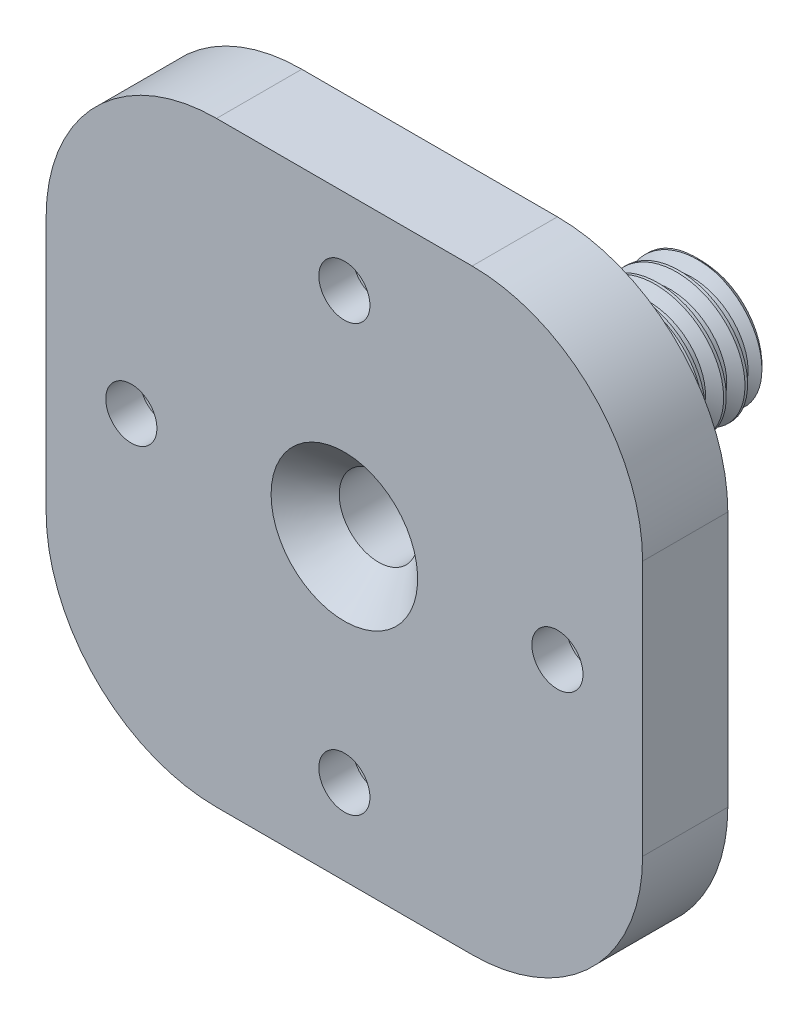
from build123d import *

# Parameters (mm, degrees)
CROQUIS1_R                 = 3.9
SALIENTE_EXTRUIR1_DEPTH    = 7
CHAFL_N2_SIZE              = 0.4
ROSCA1_PITCH               = 1.25
CROQUIS20_R                = 3.95
SALIENTE_EXTRUIR2_DEPTH    = 7
CROQUIS21_R                = 5.5
SALIENTE_EXTRUIR3_DEPTH    = 2
CROQUIS23_W                = 35
CROQUIS23_H                = 35
CROQUIS23_R                = 1.5
SALIENTE_EXTRUIR4_DEPTH    = 5
CHAFL_N3_SIZE              = 2
CROQUIS24_R                = 3.5
CORTAR_EXTRUIR2_DEPTH      = 3
CORTAR_EXTRUIR1_DEPTH      = 29.434134416
CORTAR_EXTRUIR1_DEPTH_BACK = 29.434134416
CROQUIS1_3_R               = 2.3
CHAFL_N4_SIZE              = 2
REDONDEO1_R                = 10


with BuildPart() as part:
    # Croquis1 → Saliente-Extruir1 (new body)
    with BuildSketch(Plane.XY):
        Circle(CROQUIS1_R)
    extrude(amount=-SALIENTE_EXTRUIR1_DEPTH)

    # Chaflán2
    chafl_n2_edges = [part.edges().sort_by_distance(p)[0] for p in [
        (-3.9, 0, -7),
    ]]
    chamfer(chafl_n2_edges, length=CHAFL_N2_SIZE)

    # Rosca1: the profile of Perfil de rosca1 profile screwed along a right-hand helix of 7.2 turns, 8 arcs to a turn; built about Z, then put on its axis
    rosca1_z = Axis((0, 0, 0), (0, 0, 1))
    rosca1_corners = [(3.9003, 0, -0.000173205), (3.9003, 0, 1.093923202), (3.223417656, 0, 0.703124998), (3.223417656, 0, 0.390624998)]
    with BuildLine(mode=Mode.PRIVATE) as rosca1_profile:
        Line(rosca1_corners[0], rosca1_corners[1])
        Line(rosca1_corners[1], rosca1_corners[2])
        Line(rosca1_corners[2], rosca1_corners[3])
        Line(rosca1_corners[3], rosca1_corners[0])
    rosca1_cap = Face(rosca1_profile.wire())
    rosca1_turn_angles = [0, 22.5, 45, 67.5, 90, 112.5, 135, 157.5, 180, 202.5, 225, 247.5, 270, 292.5, 315, 337.5, 360]
    rosca1_turn_weights = [1, 0.9238795325112867, 1, 0.9238795325112867, 1, 0.9238795325112867, 1, 0.9238795325112867, 1, 0.9238795325112867, 1, 0.9238795325112867, 1, 0.9238795325112867, 1, 0.9238795325112867, 1]
    rosca1_turn_rails = [Edge.make_bspline([Vector(p[0], p[1], 0).rotate(rosca1_z, rosca1_turn_angles[k]) / rosca1_turn_weights[k] + Vector(0, 0, p[2] + ROSCA1_PITCH * rosca1_turn_angles[k] / 360) for k in range(17)], [0, 0, 0, 1, 1, 2, 2, 3, 3, 4, 4, 5, 5, 6, 6, 7, 7, 8, 8, 8], 2, rosca1_turn_weights) for p in rosca1_corners]
    rosca1_turn_sides = [Face.make_surface_from_curves(rosca1_turn_rails[p[0]], rosca1_turn_rails[p[1]]) for p in [(0, 1), (1, 2), (2, 3), (3, 0)]]
    rosca1_last_angles = [2520, 2542.5, 2565, 2578.5, 2592]
    rosca1_last_weights = [1, 0.9238795325112867, 1, 0.9723699203976766, 1]
    rosca1_last_rails = [Edge.make_bspline([Vector(p[0], p[1], 0).rotate(rosca1_z, rosca1_last_angles[k]) / rosca1_last_weights[k] + Vector(0, 0, p[2] + ROSCA1_PITCH * rosca1_last_angles[k] / 360) for k in range(5)], [0, 0, 0, 1, 1, 2, 2, 2], 2, rosca1_last_weights) for p in rosca1_corners]
    rosca1_last_sides = [Face.make_surface_from_curves(rosca1_last_rails[p[0]], rosca1_last_rails[p[1]]) for p in [(0, 1), (1, 2), (2, 3), (3, 0)]]
    rosca1 = Plane(origin=(0, 0, -8.1), x_dir=(1, 0, 0), z_dir=(0, 0, 1)) * Solid(Shell([*[p.moved(Location((0, 0, ROSCA1_PITCH * i))) for i in range(7) for p in rosca1_turn_sides], *rosca1_last_sides, rosca1_cap, rosca1_cap.rotate(rosca1_z, 2592).moved(Location((0, 0, ROSCA1_PITCH * 2592 / 360)))]))
    add(rosca1, mode=Mode.SUBTRACT)

    # Croquis20 → Saliente-Extruir2 (add)
    with BuildSketch(Plane.XY):
        Circle(CROQUIS20_R)
    extrude(amount=SALIENTE_EXTRUIR2_DEPTH)

    # Croquis21 → Saliente-Extruir3 (add)
    with BuildSketch(Plane.XY.offset(7)):
        Circle(CROQUIS21_R)
    extrude(amount=SALIENTE_EXTRUIR3_DEPTH)

    # Croquis23 → Saliente-Extruir4 (add)
    with BuildSketch(Plane.XY.offset(9)):
        Rectangle(CROQUIS23_W, CROQUIS23_H)
        with Locations((-12.5, 0)):
            Circle(CROQUIS23_R, mode=Mode.SUBTRACT)
        with Locations((12.5, 0)):
            Circle(CROQUIS23_R, mode=Mode.SUBTRACT)
        with Locations((0, -12.5)):
            Circle(CROQUIS23_R, mode=Mode.SUBTRACT)
        with Locations((0, 12.5)):
            Circle(CROQUIS23_R, mode=Mode.SUBTRACT)
    extrude(amount=SALIENTE_EXTRUIR4_DEPTH)

    # Chaflán3
    chafl_n3_edges = [part.edges().sort_by_distance(p)[0] for p in [
        (-5.5, 0, 9),
    ]]
    chamfer(chafl_n3_edges, length=CHAFL_N3_SIZE - 0.0001)  # a hair under: the kernel refuses the full size

    # Croquis24 → Cortar-Extruir2 (cut)
    with BuildSketch(Plane(origin=(0, 0, 9), x_dir=(-1, 0, 0), z_dir=(0, 0, -1))):
        with Locations((12.5, 0)):
            Circle(CROQUIS24_R)
        with Locations((0, -12.5)):
            Circle(CROQUIS24_R)
        with Locations((-12.5, 0)):
            Circle(CROQUIS24_R)
        with Locations((0, 12.5)):
            Circle(CROQUIS24_R)
    extrude(amount=-CORTAR_EXTRUIR2_DEPTH, mode=Mode.SUBTRACT)

    # Croquis1<3> → Cortar-Extruir1 (cut, two sides: drawn at the far end of the back side and taken through both)
    with BuildSketch(Plane.XY.offset(-CORTAR_EXTRUIR1_DEPTH_BACK)):
        Circle(CROQUIS1_3_R)
    extrude(amount=CORTAR_EXTRUIR1_DEPTH + CORTAR_EXTRUIR1_DEPTH_BACK, mode=Mode.SUBTRACT)

    # Chaflán4
    chafl_n4_edges = [part.edges().sort_by_distance(p)[0] for p in [
        (-2.3, 0, 14),
    ]]
    chamfer(chafl_n4_edges, length=CHAFL_N4_SIZE)

    # Redondeo1
    redondeo1_edges = [part.edges().sort_by_distance(p)[0] for p in [
        (17.5, -17.5, 11.5),
        (17.5, 17.5, 11.5),
        (-17.5, 17.5, 11.5),
        (-17.5, -17.5, 11.5),
    ]]
    fillet(redondeo1_edges, radius=REDONDEO1_R)


solid = part.part
